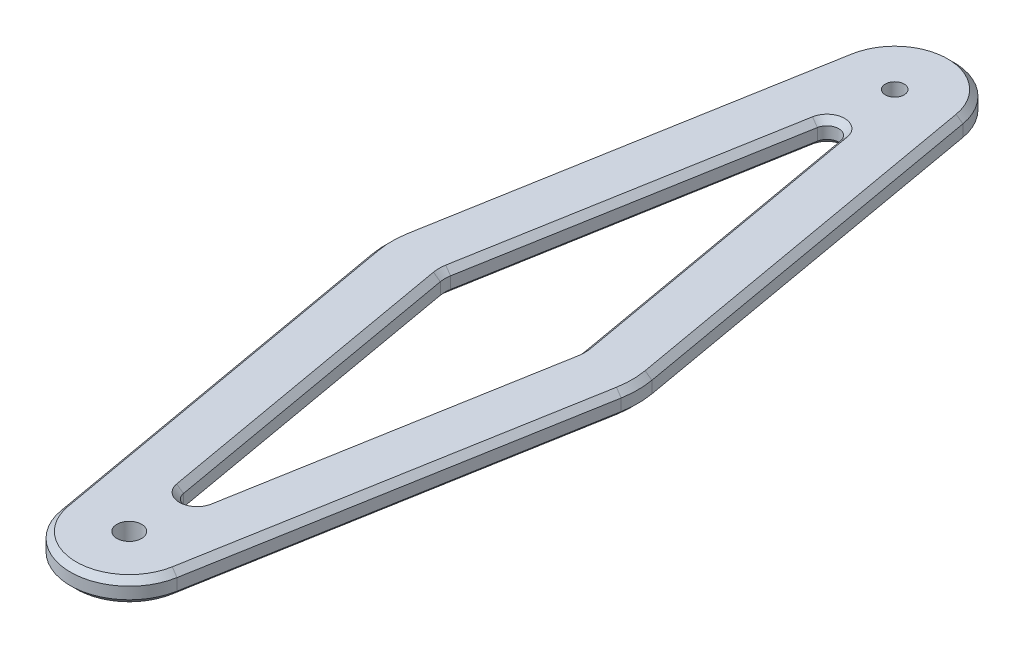
from build123d import *

# Parameters (mm, degrees)
EXTRUDE_1_DEPTH          = 2
SKETCH_2_R               = 1.6
SKETCH_2_R_2             = 2.1
CUT_EXTRUDE_1_DEPTH      = 79.091488765
CUT_EXTRUDE_4_DEPTH      = 79.014617973
CUT_EXTRUDE_4_DEPTH_BACK = 79.014617973
CHAMFER_1_SIZE           = 1


with BuildPart() as part:
    # 草图1 → 凸台-拉伸1 (new, symmetric)
    with BuildSketch(Plane(origin=(0, 0, 0), x_dir=(1, 0, 0), z_dir=(0, 1, 0))):
        with BuildLine():
            Line((-21.156236982, 2.604722665), (-9.84807753, 66.736481777))
            ThreePointArc((-9.84807753, 66.736481777), (0, 75), (9.84807753, 66.736481777))
            Line((9.84807753, 66.736481777), (21.156236982, 2.604722665))
            ThreePointArc((21.156236982, 2.604722665), (21.384120687, 0), (21.156236982, -2.604722665))
            Line((21.156236982, -2.604722665), (9.84807753, -66.736481777))
            ThreePointArc((9.84807753, -66.736481777), (0, -75), (-9.84807753, -66.736481777))
            Line((-9.84807753, -66.736481777), (-21.156236982, -2.604722665))
            ThreePointArc((-21.156236982, -2.604722665), (-21.384120687, 0), (-21.156236982, 2.604722665))
        make_face()
    extrude(amount=EXTRUDE_1_DEPTH, both=True)

    # 草图2 → 切除-拉伸1 (cut, through all)
    with BuildSketch(Plane(origin=(0, 2, 0), x_dir=(1, 0, 0), z_dir=(0, 1, 0))):
        with Locations((0, 65)):
            Circle(SKETCH_2_R)
        with Locations((0, -65)):
            Circle(SKETCH_2_R_2)
    extrude(amount=-CUT_EXTRUDE_1_DEPTH, mode=Mode.SUBTRACT)

    # 草图6 → 切除-拉伸4 (cut, two sides: drawn at the far end of the back side and taken through both)
    with BuildSketch(Plane(origin=(0, 0, 0), x_dir=(1, 0, 0), z_dir=(0, 1, 0)).offset(-CUT_EXTRUDE_4_DEPTH_BACK)):
        with BuildLine():
            Line((-1.969615506, 53.829755389), (-11.308159452, 0.868240888))
            ThreePointArc((-11.308159452, 0.868240888), (-11.384120687, 0), (-11.308159452, -0.868240888))
            Line((-11.308159452, -0.868240888), (-1.969615506, -53.829755389))
            ThreePointArc((-1.969615506, -53.829755389), (0, -55.482459034), (1.969615506, -53.829755389))
            Line((1.969615506, -53.829755389), (11.308159452, -0.868240888))
            ThreePointArc((11.308159452, -0.868240888), (11.384120687, 0), (11.308159452, 0.868240888))
            Line((11.308159452, 0.868240888), (1.969615506, 53.829755389))
            ThreePointArc((1.969615506, 53.829755389), (0, 55.482459034), (-1.969615506, 53.829755389))
        make_face()
    extrude(amount=CUT_EXTRUDE_4_DEPTH + CUT_EXTRUDE_4_DEPTH_BACK, mode=Mode.SUBTRACT)

    # 倒角1
    chamfer_1_edges = [part.edges().sort_by_distance(p)[0] for p in [
        (-15.502157256, 2, -34.670602221),
        (-21.384120687, 2, 0),
        (0, 2, -75),
        (-15.502157256, 2, 34.670602221),
        (15.502157256, 2, -34.670602221),
        (0, 2, 75),
        (21.384120687, 2, 0),
        (15.502157256, 2, 34.670602221),
        (-15.502157256, -2, 34.670602221),
        (0, -2, 75),
        (-21.384120687, -2, 0),
        (15.502157256, -2, 34.670602221),
        (-15.502157256, -2, -34.670602221),
        (21.384120687, -2, 0),
        (0, -2, -75),
        (15.502157256, -2, -34.670602221),
        (-6.638887479, -2, 27.348998139),
        (-6.638887479, -2, -27.348998139),
        (0, -2, 55.482459034),
        (0, -2, -55.482459034),
        (6.638887479, -2, 27.348998139),
        (6.638887479, -2, -27.348998139),
        (6.638887479, 2, 27.348998139),
        (6.638887479, 2, -27.348998139),
        (0, 2, 55.482459034),
        (0, 2, -55.482459034),
        (-6.638887479, 2, 27.348998139),
        (-6.638887479, 2, -27.348998139),
        (-11.384120687, -2, 0),
        (11.384120687, -2, 0),
        (11.384120687, 2, 0),
        (-11.384120687, 2, 0),
    ]]
    chamfer(chamfer_1_edges, length=CHAMFER_1_SIZE)


solid = part.part
